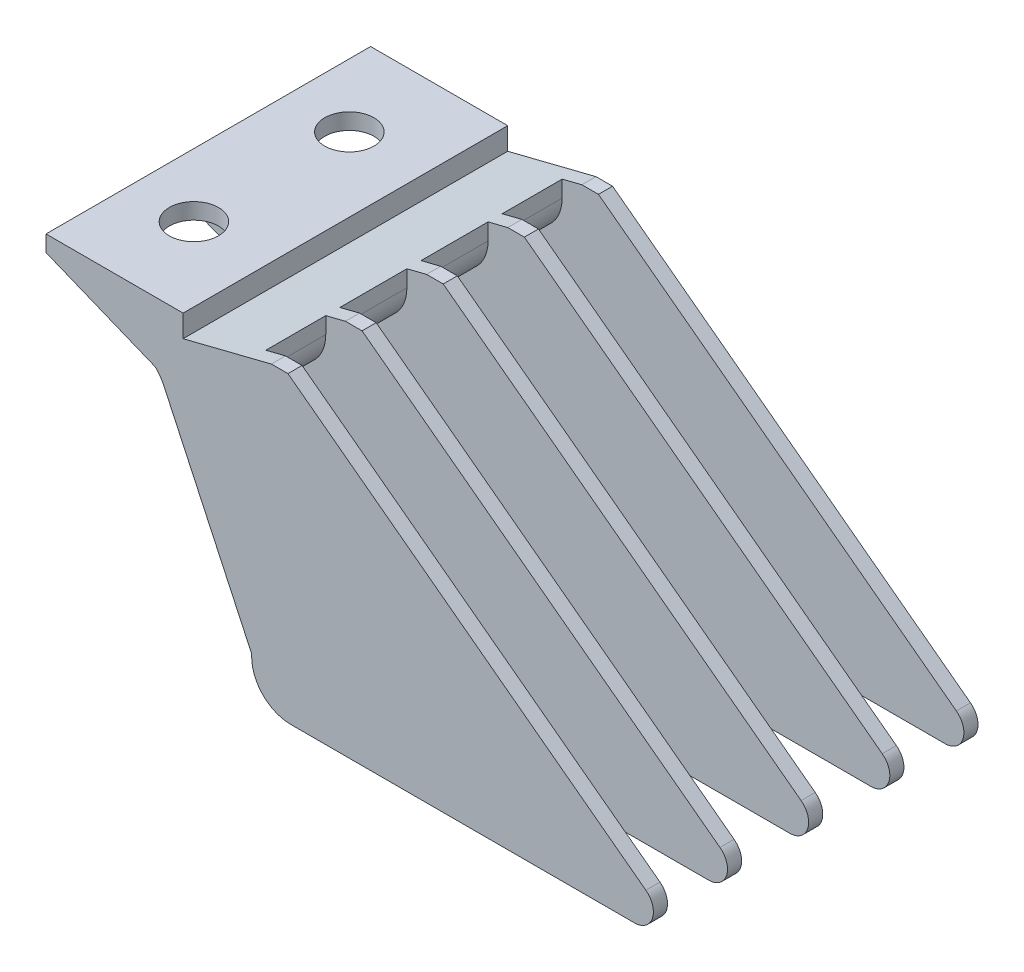
from build123d import *
from OCP.BRepFilletAPI import BRepFilletAPI_MakeChamfer

# Parameters (mm, degrees)
BOSS_EXTRUDE1_DEPTH = 40.894
SKETCH3_W           = 13.757082797
SKETCH3_H           = 5.588
CUT_EXTRUDE2_DEPTH  = 40.894
SKETCH6_W           = 7.5565
SKETCH6_H           = 30.48
SKETCH6_H_2         = 7.62
SKETCH6_W_2         = 8.4455
CUT_EXTRUDE4_DEPTH  = 72.423246356
FILLET1_R           = 2.38
FILLET2_R           = 4.92
CHAMFER1_SIZE       = 25.24
CHAMFER1_SIZE2      = 11.769605292
SKETCH9_R           = 3.0988
CUT_EXTRUDE5_DEPTH  = 83.027180008
BOSS_EXTRUDE3_DEPTH = 5.08
BOSS_EXTRUDE4_DEPTH = 5.08
FILLET3_R           = 4.92
FILLET4_R           = 4.92


with BuildPart() as part:
    # Sketch1 → Boss-Extrude1 (new body)
    with BuildSketch(Plane.XY):
        Polygon((66.04, -19.05), (15.24, 19.05), (-15.24, 19.05), (-15.24, 11.43), (10.668, 11.43), (10.668, -19.05), align=None)
    extrude(amount=-BOSS_EXTRUDE1_DEPTH)

    # Sketch3 → Cut-Extrude2 (cut)
    with BuildSketch(Plane(origin=(0, 0, -40.894), x_dir=(-1, 0, 0), z_dir=(0, 0, -1))):
        with Locations((8.361458602, 14.224)):
            Rectangle(SKETCH3_W, SKETCH3_H)
        Polygon((-2.032, 16.256), (-2.032, 19.05), (-13.15212, 19.05), align=None)
    extrude(amount=-CUT_EXTRUDE2_DEPTH, mode=Mode.SUBTRACT)

    # Sketch6 → Cut-Extrude4 (cut, through all)
    with BuildSketch(Plane.ZY.offset(-10.668)):
        with Locations((-35.33775, -3.81)):
            Rectangle(SKETCH6_W, SKETCH6_H)
        with Locations((-35.33775, 15.24)):
            Rectangle(SKETCH6_W, SKETCH6_H_2)
        with Locations((-25.55875, 15.24)):
            Rectangle(SKETCH6_W_2, SKETCH6_H_2)
        with Locations((-25.55875, -3.81)):
            Rectangle(SKETCH6_W_2, SKETCH6_H)
        with Locations((-15.33525, -3.81)):
            Rectangle(SKETCH6_W_2, SKETCH6_H)
        with Locations((-15.33525, 15.24)):
            Rectangle(SKETCH6_W_2, SKETCH6_H_2)
        with Locations((-5.55625, 15.24)):
            Rectangle(SKETCH6_W, SKETCH6_H_2)
        with Locations((-5.55625, -3.81)):
            Rectangle(SKETCH6_W, SKETCH6_H)
    extrude(amount=-CUT_EXTRUDE4_DEPTH, mode=Mode.SUBTRACT)

    # Fillet1
    fillet1_edges = [part.edges().sort_by_distance(p)[0] for p in [
        (66.04, -19.05, -40.005),
        (66.04, -19.05, -30.6705),
        (66.04, -19.05, -20.447),
        (66.04, -19.05, -10.2235),
        (66.04, -19.05, -0.889),
    ]]
    fillet(fillet1_edges, radius=FILLET1_R)

    # Fillet2
    fillet2_edges = [part.edges().sort_by_distance(p)[0] for p in [
        (10.668, -19.05, -40.005),
        (10.668, -19.05, -30.6705),
        (10.668, -19.05, -20.447),
        (10.668, -19.05, -10.2235),
        (10.668, -19.05, -0.889),
    ]]
    fillet(fillet2_edges, radius=FILLET2_R)

    # Chamfer1: one chamfer whose edges measure the first distance from different faces: ONE call of the kernel's chamfer builder (chamfer() names one face for all edges)
    chamfer1_edges_1 = [part.edges().sort_by_distance(p)[0] for p in [
        (10.668, 11.43, -40.005),
    ]]
    chamfer1_side_1 = [part.faces().sort_by_distance(p)[0] for p in [
        (10.668, -1.35, -40.005),
    ]]
    chamfer1_edges_2 = [part.edges().sort_by_distance(p)[0] for p in [
        (10.668, 11.43, -30.6705),
    ]]
    chamfer1_side_2 = [part.faces().sort_by_distance(p)[0] for p in [
        (10.668, -1.35, -30.6705),
    ]]
    chamfer1_edges_3 = [part.edges().sort_by_distance(p)[0] for p in [
        (10.668, 11.43, -20.447),
    ]]
    chamfer1_side_3 = [part.faces().sort_by_distance(p)[0] for p in [
        (10.668, -1.35, -20.447),
    ]]
    chamfer1_edges_4 = [part.edges().sort_by_distance(p)[0] for p in [
        (10.668, 11.43, -10.2235),
    ]]
    chamfer1_side_4 = [part.faces().sort_by_distance(p)[0] for p in [
        (10.668, -1.35, -10.2235),
    ]]
    chamfer1_edges_5 = [part.edges().sort_by_distance(p)[0] for p in [
        (10.668, 11.43, -0.889),
    ]]
    chamfer1_side_5 = [part.faces().sort_by_distance(p)[0] for p in [
        (10.668, -1.35, -0.889),
    ]]
    chamfer1 = BRepFilletAPI_MakeChamfer(part.part.solid().wrapped)
    for e in chamfer1_edges_1:
        chamfer1.Add(CHAMFER1_SIZE, CHAMFER1_SIZE2, e.wrapped, chamfer1_side_1[0].wrapped)  # the first distance lies on this face
    for e in chamfer1_edges_2:
        chamfer1.Add(CHAMFER1_SIZE, CHAMFER1_SIZE2, e.wrapped, chamfer1_side_2[0].wrapped)  # the first distance lies on this face
    for e in chamfer1_edges_3:
        chamfer1.Add(CHAMFER1_SIZE, CHAMFER1_SIZE2, e.wrapped, chamfer1_side_3[0].wrapped)  # the first distance lies on this face
    for e in chamfer1_edges_4:
        chamfer1.Add(CHAMFER1_SIZE, CHAMFER1_SIZE2, e.wrapped, chamfer1_side_4[0].wrapped)  # the first distance lies on this face
    for e in chamfer1_edges_5:
        chamfer1.Add(CHAMFER1_SIZE, CHAMFER1_SIZE2, e.wrapped, chamfer1_side_5[0].wrapped)  # the first distance lies on this face
    add(Compound.cast(chamfer1.Shape()), mode=Mode.REPLACE)

    # Sketch9 → Cut-Extrude5 (cut, through all)
    with BuildSketch(Plane.XZ.offset(-17.018)):
        with Locations(Location((-7.2644, -10.6553, 0), (0, 0, 270))):
            Circle(SKETCH9_R)
        with Locations(Location((-7.2644, -30.2387, 0), (0, 0, 270))):
            Circle(SKETCH9_R)
    extrude(amount=-CUT_EXTRUDE5_DEPTH, mode=Mode.SUBTRACT)

    # Sketch10 → Boss-Extrude3 (add, symmetric)
    with BuildSketch(Plane(origin=(0, 0, -20.447), x_dir=(-1, 0, 0), z_dir=(0, 0, -1))):
        Polygon((1.482917203, 17.018), (15.24, 17.018), (1.482917203, 11.43), align=None)
    extrude(amount=BOSS_EXTRUDE3_DEPTH, both=True)

    # Sketch11 → Boss-Extrude4 (add)
    with BuildSketch(Plane(origin=(0, 0, -40.894), x_dir=(-1, 0, 0), z_dir=(0, 0, -1))):
        Polygon((1.482917203, 17.018), (15.24, 17.018), (1.482917203, 11.43), align=None)
    boss_extrude4 = extrude(amount=-BOSS_EXTRUDE4_DEPTH)

    # Mirror1: Boss-Extrude4 across plane
    add(boss_extrude4.mirror(Plane(origin=(0, 0, -20.447), x_dir=(1, 0, 0), z_dir=(0, 0, -1))))

    # Fillet3
    fillet3_edges = [part.edges().sort_by_distance(p)[0] for p in [
        (10.668, 11.43, -25.55875),
        (10.668, 11.43, -15.33525),
        (10.668, 11.43, -5.55625),
        (10.668, 11.43, -35.33775),
    ]]
    fillet(fillet3_edges, radius=FILLET3_R)

    # Fillet4
    # the kernel refuses this fillet: 4.92 mm, written as the material it adds along each edge
    with BuildSketch(Plane(origin=(-1.101605292, 11.43, 0), x_dir=(-1, 0, 0), z_dir=(0, 0, -1)), Plane(origin=(-1.101605292, 11.43, -39.116), x_dir=(-1, 0, 0), z_dir=(0, 0, -1)), Plane(origin=(-1.101605292, 11.43, -29.7815), x_dir=(-1, 0, 0), z_dir=(0, 0, -1)), Plane(origin=(-1.101605292, 11.43, -19.558), x_dir=(-1, 0, 0), z_dir=(0, 0, -1)), Plane(origin=(-1.101605292, 11.43, -9.3345), x_dir=(-1, 0, 0), z_dir=(0, 0, -1))) as fillet4_piece_1:
        with BuildLine():
            CenterArc((3.761612208, -3.574908377), FILLET4_R, 133.397271211, 21.602728789)
            Line((-0.697422104, -1.495626529), (-0.78660279, -1.454040892))
            Line((-0.78660279, -1.454040892), (-0.089180686, 0.041585637))
            Line((-0.089180686, 0.041585637), (0, 0.0984))
            ThreePointArc((0, 0.0984), (0.190655955, 0.0984), (0.313705905, 0.071498168))
            Line((0.313705905, 0.071498168), (0.381311911, 0))
        make_face()
    extrude(amount=1.778)


solid = part.part
